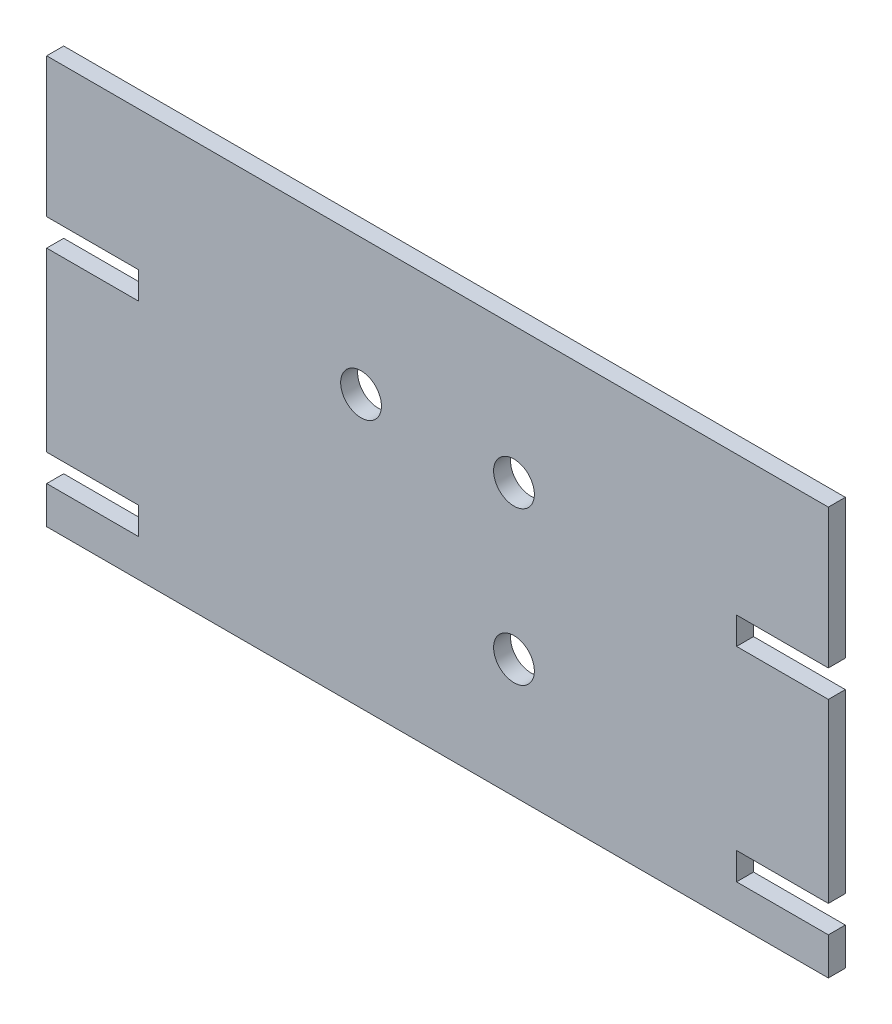
from build123d import *

# Parameters (mm, degrees)
SKETCH1_W           = 230
SKETCH1_H           = 120
BOSS_EXTRUDE1_DEPTH = 5
CUT_EXTRUDE1_REACH  = 131.808
SKETCH2_W           = 27
SKETCH2_H           = 8.000000001
CUT_EXTRUDE2_REACH  = 131.808
SKETCH3_R           = 6


with BuildPart() as part:
    # Sketch1 → Boss-Extrude1 (new body)
    with BuildSketch(Plane.XY):
        Rectangle(SKETCH1_W, SKETCH1_H)
    extrude(amount=BOSS_EXTRUDE1_DEPTH)

    # Sketch2 → Cut-Extrude1 (cut, up to next)
    with BuildSketch(Plane(origin=(0, 0, 0), x_dir=(-1, 0, 0), z_dir=(0, 0, -1)), mode=Mode.PRIVATE) as cut_extrude1_sk1:
        with Locations((101.5, 15.000000001)):
            Rectangle(SKETCH2_W, SKETCH2_H)
    cut_extrude1_tool1 = extrude(cut_extrude1_sk1.sketch, amount=-CUT_EXTRUDE1_REACH, mode=Mode.PRIVATE) & part.part
    # Sketch2 → Cut-Extrude1 (cut, up to next)
    with BuildSketch(Plane(origin=(0, 0, 0), x_dir=(-1, 0, 0), z_dir=(0, 0, -1)), mode=Mode.PRIVATE) as cut_extrude1_sk2:
        with Locations((101.5, -45.000000001)):
            Rectangle(SKETCH2_W, SKETCH2_H)
    cut_extrude1_tool2 = extrude(cut_extrude1_sk2.sketch, amount=-CUT_EXTRUDE1_REACH, mode=Mode.PRIVATE) & part.part
    # Sketch2 → Cut-Extrude1 (cut, up to next)
    with BuildSketch(Plane(origin=(0, 0, 0), x_dir=(-1, 0, 0), z_dir=(0, 0, -1)), mode=Mode.PRIVATE) as cut_extrude1_sk3:
        with Locations((-101.5, -45.000000001)):
            Rectangle(SKETCH2_W, SKETCH2_H)
    cut_extrude1_tool3 = extrude(cut_extrude1_sk3.sketch, amount=-CUT_EXTRUDE1_REACH, mode=Mode.PRIVATE) & part.part
    # Sketch2 → Cut-Extrude1 (cut, up to next)
    with BuildSketch(Plane(origin=(0, 0, 0), x_dir=(-1, 0, 0), z_dir=(0, 0, -1)), mode=Mode.PRIVATE) as cut_extrude1_sk4:
        with Locations((-101.5, 15.000000001)):
            Rectangle(SKETCH2_W, SKETCH2_H)
    cut_extrude1_tool4 = extrude(cut_extrude1_sk4.sketch, amount=-CUT_EXTRUDE1_REACH, mode=Mode.PRIVATE) & part.part
    add(cut_extrude1_tool1.solids().sort_by_distance((-101.5, 15, 0))[0], mode=Mode.SUBTRACT)
    add(cut_extrude1_tool2.solids().sort_by_distance((-101.5, -45, 0))[0], mode=Mode.SUBTRACT)
    add(cut_extrude1_tool3.solids().sort_by_distance((101.5, -45, 0))[0], mode=Mode.SUBTRACT)
    add(cut_extrude1_tool4.solids().sort_by_distance((101.5, 15, 0))[0], mode=Mode.SUBTRACT)

    # Sketch3 → Cut-Extrude2 (cut, up to next)
    with BuildSketch(Plane.XY.offset(5), mode=Mode.PRIVATE) as cut_extrude2_sk1:
        with Locations((22.5, 20)):
            Circle(SKETCH3_R)
    cut_extrude2_tool1 = extrude(cut_extrude2_sk1.sketch, amount=-CUT_EXTRUDE2_REACH, mode=Mode.PRIVATE) & part.part
    # Sketch3 → Cut-Extrude2 (cut, up to next)
    with BuildSketch(Plane.XY.offset(5), mode=Mode.PRIVATE) as cut_extrude2_sk2:
        with Locations((-22.5, 20)):
            Circle(SKETCH3_R)
    cut_extrude2_tool2 = extrude(cut_extrude2_sk2.sketch, amount=-CUT_EXTRUDE2_REACH, mode=Mode.PRIVATE) & part.part
    # Sketch3 → Cut-Extrude2 (cut, up to next)
    with BuildSketch(Plane.XY.offset(5), mode=Mode.PRIVATE) as cut_extrude2_sk3:
        with Locations((22.5, -25)):
            Circle(SKETCH3_R)
    cut_extrude2_tool3 = extrude(cut_extrude2_sk3.sketch, amount=-CUT_EXTRUDE2_REACH, mode=Mode.PRIVATE) & part.part
    add(cut_extrude2_tool1.solids().sort_by_distance((22.5, 20, 5))[0], mode=Mode.SUBTRACT)
    add(cut_extrude2_tool2.solids().sort_by_distance((-22.5, 20, 5))[0], mode=Mode.SUBTRACT)
    add(cut_extrude2_tool3.solids().sort_by_distance((22.5, -25, 5))[0], mode=Mode.SUBTRACT)


solid = part.part
